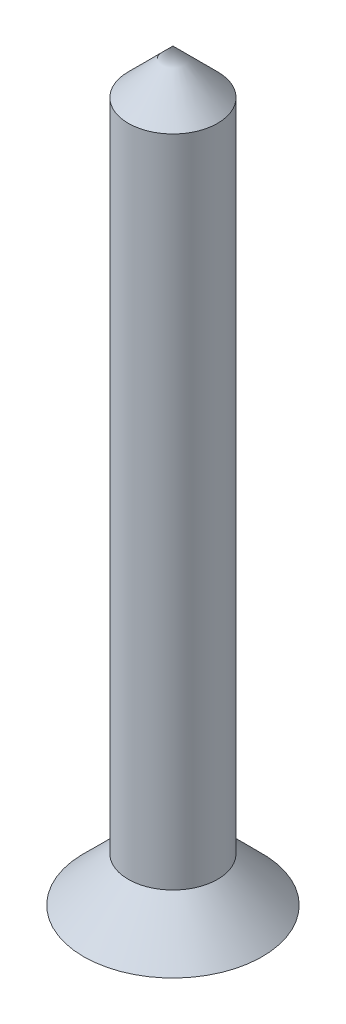
from build123d import *

# Parameters (mm, degrees)
SKETCH1_R           = 6
SKETCH1_R_2         = 3
BOSS_EXTRUDE1_DEPTH = 3
SKETCH1_2_R         = 3
BOSS_EXTRUDE2_DEPTH = 50
CHAMFER1_SIZE       = 3


with BuildPart() as part:
    # Sketch1 → Boss-Extrude1 (new body)
    with BuildSketch(Plane(origin=(0, 0, 0), x_dir=(1, 0, 0), z_dir=(0, 1, 0))):
        with Locations(Location((0, 0, 0), (0, 0, 270))):
            Circle(SKETCH1_R)
        with Locations(Location((0, 0, 0), (0, 0, 270))):
            Circle(SKETCH1_R_2, mode=Mode.SUBTRACT)
    extrude(amount=BOSS_EXTRUDE1_DEPTH)

    # Sketch1<2> → Boss-Extrude2 (add)
    with BuildSketch(Plane(origin=(0, 0, 0), x_dir=(1, 0, 0), z_dir=(0, 1, 0))):
        with Locations(Location((0, 0, 0), (0, 0, 270))):
            Circle(SKETCH1_2_R)
    extrude(amount=BOSS_EXTRUDE2_DEPTH)

    # Chamfer1
    chamfer1_edges = [part.edges().sort_by_distance(p)[0] for p in [
        (0, 50, -3),
        (0, 3, -6),
    ]]
    chamfer(chamfer1_edges, length=CHAMFER1_SIZE - 0.0001)  # a hair under: the kernel refuses the full size


solid = part.part
